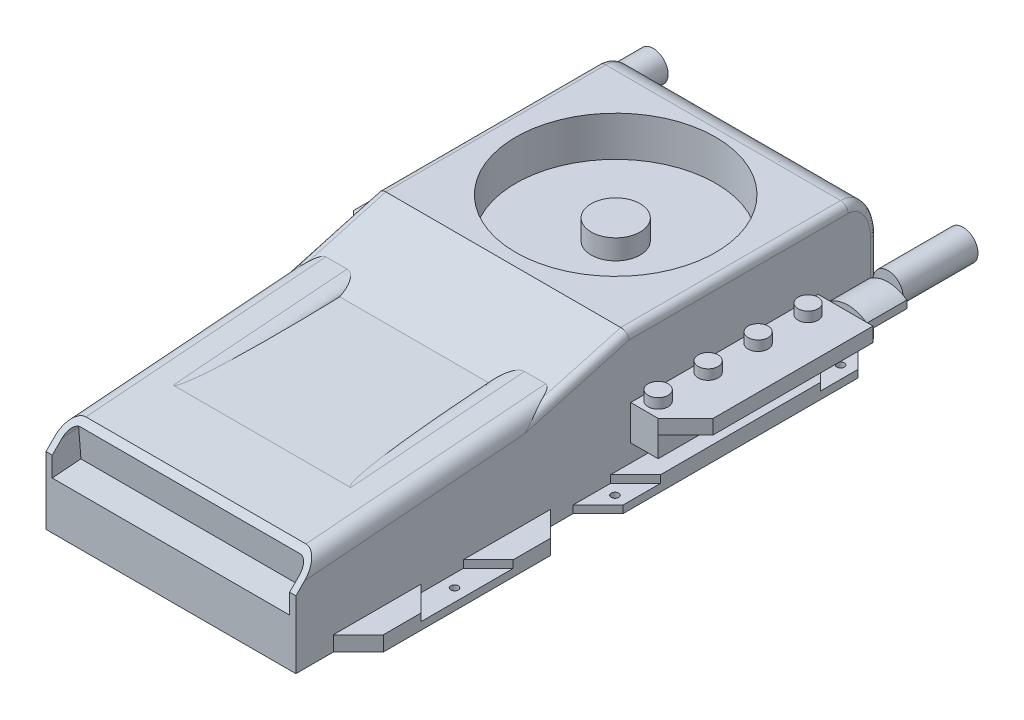
from build123d import *

# Parameters (mm, degrees)
BOSS_EXTRUDE1_DEPTH     = 50
FILLET1_SIZE            = 12
FILLET1_SIZE_2          = 16
SKETCH2_R               = 40
CUT_EXTRUDE1_DEPTH      = 16
SKETCH5_W               = 95
SKETCH5_H               = 15
CUT_EXTRUDE4_DEPTH      = 13
CUT_EXTRUDE5_DEPTH      = 29.5
FILLET2_R               = 6
FILLET3_R               = 3.5
FILLET4_R               = 3
FILLET5_SIZE            = 6
FILLET5_SIZE_2          = 2.41
FILLET6_SIZE            = 6
FILLET6_SIZE_2          = 2.41
BOSS_EXTRUDE2_DEPTH     = 6
SKETCH8_R               = 1.5
CUT_EXTRUDE6_DEPTH      = 141.983155142
CUT_EXTRUDE7_DEPTH      = 3
SKETCH10_W              = 11
SKETCH10_H              = 75
BOSS_EXTRUDE3_DEPTH     = 14
BOSS_EXTRUDE4_DEPTH     = 5.75
SKETCH11_R              = 4
BOSS_EXTRUDE5_DEPTH     = 4
LPATTERN1_COUNT         = 4
LPATTERN1_PITCH         = 20
SKETCH12_W              = 15
SKETCH12_H              = 3
BOSS_EXTRUDE6_DEPTH     = 16
BOSS_EXTRUDE7_DEPTH     = 30
MIRROR2_COPY_1_SKETCH_R = 4
MIRROR2_COPY_1_DEPTH    = 4
MIRROR2_COPY_2_SKETCH_R = 4
MIRROR2_COPY_2_DEPTH    = 4
MIRROR2_COPY_3_SKETCH_R = 4
MIRROR2_COPY_3_DEPTH    = 4
SKETCH14_R              = 9.805462556
BOSS_EXTRUDE8_DEPTH     = 8


with BuildPart() as part:
    # Sketch1 → Boss-Extrude1 (new, symmetric)
    with BuildSketch(Plane(origin=(0, 0, 0), x_dir=(0, 0, -1), z_dir=(1, 0, 0))):
        Polygon((-106.5, 18.5), (-116.5, 8.5), (-116.5, -18.5), (116.5, -18.5), (116.5, 18.5), align=None)
        Polygon((-10.5, 26), (-106.5, 18.5), (116.5, 18.5), (116.5, 33.5), (16.5, 33.5), align=None)
    extrude(amount=BOSS_EXTRUDE1_DEPTH, both=True)

    # Fillet1
    # an asymmetric fillet: 16, 12 mm, written as the material it takes off along each edge
    with BuildSketch(Plane(origin=(90, 33.5, -116.5), x_dir=(0, 0, 1), z_dir=(-1, 0, 0))) as fillet1_piece_1:
        with BuildLine():
            Bezier((FILLET1_SIZE, 0), (0, 0), (0, -FILLET1_SIZE_2), weights=[1, 0.707106781, 1])
            Line((0, -FILLET1_SIZE_2), (0, 0))
            Line((0, 0), (FILLET1_SIZE, 0))
        make_face()
    extrude(amount=180, mode=Mode.SUBTRACT)

    # Sketch2 → Cut-Extrude1 (cut)
    with BuildSketch(Plane(origin=(0, 33.5, 0), x_dir=(1, 0, 0), z_dir=(0, 1, 0))):
        with Locations(Location((0, 61.5, 0), (0, 0, 270))):
            Circle(SKETCH2_R)
    extrude(amount=-CUT_EXTRUDE1_DEPTH, mode=Mode.SUBTRACT)

    # Sketch5 → Cut-Extrude4 (cut)
    with BuildSketch(Plane(origin=(0, -9.158578015, 117.229798593), x_dir=(-1, 0, 0), z_dir=(0, 0.07788766729290961, -0.9969621413492435))):
        with Locations((0, 17.130113625)):
            Rectangle(SKETCH5_W, SKETCH5_H)
    extrude(amount=CUT_EXTRUDE4_DEPTH, mode=Mode.SUBTRACT)

    # Sketch6 → Cut-Extrude5 (cut, symmetric)
    with BuildSketch(Plane(origin=(0, 0, 0), x_dir=(0, 0, -1), z_dir=(1, 0, 0))):
        Polygon((-80.096439639, 20.562778153), (-10.5, 26), (-19.171661187, 23.591205226), align=None)
    extrude(amount=CUT_EXTRUDE5_DEPTH, both=True, mode=Mode.SUBTRACT)

    # Fillet2
    fillet2_edges = [part.edges().sort_by_distance(p)[0] for p in [
        (50, 22.25, 58.5),
        (-50, 22.25, 58.5),
    ]]
    fillet(fillet2_edges, radius=FILLET2_R)

    # Fillet3
    fillet3_edges = [part.edges().sort_by_distance(p)[0] for p in [
        (47.5, 16.307427283, 107.491035383),
        (-47.5, 16.307427283, 107.491035383),
    ]]
    fillet(fillet3_edges, radius=FILLET3_R)

    # Fillet4
    fillet4_edges = [part.edges().sort_by_distance(p)[0] for p in [
        (-50, -0.5, -116.5),
        (50, -0.5, -116.5),
        (50, 27.997177078, -113.556363297),
        (-50, 27.997177078, -113.556363297),
        (50, 33.5, -60.5),
        (-50, 33.5, -60.5),
        (-50, 25.563368562, 12.071873177),
        (50, 25.563368562, 12.071873177),
    ]]
    fillet(fillet4_edges, radius=FILLET4_R)

    # Fillet5
    # an asymmetric fillet: 6, 2.41 mm, written as the material it takes off along each edge
    with BuildSketch(Plane(origin=(-29.5, 19.394463144, 95.050871759), x_dir=(-1, 0, 0), z_dir=(0, 0.07788766729290983, -0.9969621413492435))) as fillet5_piece_1_section:
        with BuildLine():
            Bezier((FILLET5_SIZE, 0), (0, 0), (0, -FILLET5_SIZE_2), weights=[1, 0.707106781, 1])
            Line((0, -FILLET5_SIZE_2), (0, 0))
            Line((0, 0), (FILLET5_SIZE, 0))
        make_face()
    fillet5_piece_1 = extrude(amount=99.808508019, mode=Mode.PRIVATE)
    fillet5_piece_1 = split(fillet5_piece_1, bisect_by=Plane(origin=(-31.37321059, 17.883253482, 39.720287465), z_dir=(0, 0.9635179096299407, 0.26764386378609467)), keep=Keep.TOP, mode=Mode.PRIVATE)
    fillet5_piece_1 = split(fillet5_piece_1, bisect_by=Plane(origin=(-31.37321059, 22.496638276, 41.191755219), z_dir=(0, 0.9987668598742235, 0.04964634545445587)), keep=Keep.TOP, mode=Mode.PRIVATE)
    add(fillet5_piece_1, mode=Mode.SUBTRACT)

    # Fillet6
    # an asymmetric fillet: 6, 2.41 mm, written as the material it takes off along each edge
    with BuildSketch(Plane(origin=(29.5, 19.394463144, 95.050871759), x_dir=(1, 0, 0), z_dir=(0, 0.07788766729290983, -0.9969621413492435))) as fillet6_piece_1_section:
        with BuildLine():
            Bezier((FILLET6_SIZE, 0), (0, 0), (0, FILLET6_SIZE_2), weights=[1, 0.707106781, 1])
            Line((0, FILLET6_SIZE_2), (0, 0))
            Line((0, 0), (FILLET6_SIZE, 0))
        make_face()
    fillet6_piece_1 = extrude(amount=99.808508019, mode=Mode.PRIVATE)
    fillet6_piece_1 = split(fillet6_piece_1, bisect_by=Plane(origin=(31.37321059, 17.883253482, 39.720287465), z_dir=(0, 0.9635179096299407, 0.26764386378609467)), keep=Keep.TOP, mode=Mode.PRIVATE)
    fillet6_piece_1 = split(fillet6_piece_1, bisect_by=Plane(origin=(31.37321059, 22.496638276, 41.191755219), z_dir=(0, 0.9987668598742235, 0.04964634545445587)), keep=Keep.TOP, mode=Mode.PRIVATE)
    add(fillet6_piece_1, mode=Mode.SUBTRACT)

    # Sketch7 → Boss-Extrude2 (add)
    with BuildSketch(Plane.XZ.offset(18.5)):
        Polygon((-50, 101.5), (-60, 91.5), (-60, 24.5), (-50, 14.5), align=None)
        Polygon((-50, 5.5), (-60, -4.5), (-60, -98.5), (-50, -108.5), align=None)
    boss_extrude2 = extrude(amount=-BOSS_EXTRUDE2_DEPTH)

    # Sketch8 → Cut-Extrude6 (cut, through all)
    with BuildSketch(Plane.XZ.offset(18.5)):
        with Locations(Location((-55, 58, 0), (0, 0, 270))):
            Circle(SKETCH8_R)
        with Locations(Location((-55, -6.210815833, 0), (0, 0, 270))):
            Circle(SKETCH8_R)
        with Locations(Location((-55, -96.5, 0), (0, 0, 270))):
            Circle(SKETCH8_R)
    cut_extrude6 = extrude(amount=-CUT_EXTRUDE6_DEPTH, mode=Mode.SUBTRACT)

    # Sketch9 → Cut-Extrude7 (cut)
    with BuildSketch(Plane(origin=(0, -12.5, 0), x_dir=(1, 0, 0), z_dir=(0, 1, 0))):
        Polygon((-60, 83.5), (-50, 93.5), (-50, 108.5), (-60, 98.5), align=None)
        Polygon((-60, 19.5), (-50, 9.5), (-50, -5.5), (-60, 4.5), align=None)
        Polygon((-60, -39.5), (-50, -49.5), (-50, -66.5), (-60, -76.5), align=None)
    cut_extrude7 = extrude(amount=-CUT_EXTRUDE7_DEPTH, mode=Mode.SUBTRACT)

    # Mirror1: Boss-Extrude2, Cut-Extrude6, Cut-Extrude7 across plane
    add(boss_extrude2.mirror(Plane(origin=(0, 0, 0), x_dir=(0, 0, 1), z_dir=(1, 0, 0))))
    add(cut_extrude6.mirror(Plane(origin=(0, 0, 0), x_dir=(0, 0, 1), z_dir=(1, 0, 0))), mode=Mode.SUBTRACT)
    add(cut_extrude7.mirror(Plane(origin=(0, 0, 0), x_dir=(0, 0, 1), z_dir=(1, 0, 0))), mode=Mode.SUBTRACT)

    # Sketch10 → Boss-Extrude3 (add)
    with BuildSketch(Plane(origin=(0, 8.5, 0), x_dir=(1, 0, 0), z_dir=(0, 1, 0))):
        with Locations((-55.5, 55)):
            Rectangle(SKETCH10_W, SKETCH10_H)
    boss_extrude3 = extrude(amount=-BOSS_EXTRUDE3_DEPTH)

    # Sketch10<3> → Boss-Extrude4 (add)
    with BuildSketch(Plane(origin=(0, 8.5, 0), x_dir=(1, 0, 0), z_dir=(0, 1, 0))):
        Polygon((-61, 17.5), (-61, 92.5), (-72, 92.5), (-72, 28.5), align=None)
    boss_extrude4 = extrude(amount=-BOSS_EXTRUDE4_DEPTH)

    # Sketch11 → Boss-Extrude5 (add)
    with BuildSketch(Plane(origin=(0, 8.5, 0), x_dir=(1, 0, 0), z_dir=(0, 1, 0))):
        with Locations(Location((-55, 23.5, 0), (0, 0, 270))):
            Circle(SKETCH11_R)
    boss_extrude5 = extrude(amount=BOSS_EXTRUDE5_DEPTH)

    # LPattern1: Boss-Extrude5 ×4
    with Locations(*[(0, 0, -i * LPATTERN1_PITCH) for i in range(1, LPATTERN1_COUNT)]):
        add(boss_extrude5)

    # Sketch12 → Boss-Extrude6 (add)
    with BuildSketch(Plane(origin=(0, 0, -92.5), x_dir=(-1, 0, 0), z_dir=(0, 0, -1))):
        with Locations((62, 6.75)):
            Rectangle(SKETCH12_W, SKETCH12_H)
        with BuildLine():
            ThreePointArc((69.154544011, 8.5), (62, 10.75), (54.845455989, 8.5))
            Line((54.845455989, 8.5), (69.154544011, 8.5))
        make_face()
        with BuildLine():
            ThreePointArc((54.845455989, 8.5), (54.67166185, 8.376473224), (54.5, 8.25))
            Line((54.5, 8.25), (69.5, 8.25))
            ThreePointArc((69.5, 8.25), (69.32833815, 8.376473224), (69.154544011, 8.5))
            Line((69.154544011, 8.5), (54.845455989, 8.5))
        make_face()
        with BuildLine():
            Line((54.5, 5.25), (69.5, 5.25))
            ThreePointArc((69.5, 5.25), (62, 2.75), (54.5, 5.25))
        make_face()
    boss_extrude6 = extrude(amount=BOSS_EXTRUDE6_DEPTH)

    # Sketch13 → Boss-Extrude7 (add)
    with BuildSketch(Plane(origin=(0, 0, -108.5), x_dir=(-1, 0, 0), z_dir=(0, 0, -1))):
        with BuildLine():
            ThreePointArc((61.999999953, 2.75), (66.242640671, 4.507359296), (68, 8.75))
            ThreePointArc((68, 8.75), (67.995266558, 8.988283221), (67.981073702, 9.226190476))
            ThreePointArc((67.981073702, 9.226190476), (62, 10.75), (56.018926298, 9.226190476))
            ThreePointArc((56.018926298, 9.226190476), (57.592214664, 4.67919806), (61.999999953, 2.75))
        make_face()
        with BuildLine():
            ThreePointArc((56.018926298, 9.226190476), (62, 10.75), (67.981073702, 9.226190476))
            ThreePointArc((67.981073702, 9.226190476), (62, 14.75), (56.018926298, 9.226190476))
        make_face()
    boss_extrude7 = extrude(amount=BOSS_EXTRUDE7_DEPTH)

    # Mirror2: Boss-Extrude3, Boss-Extrude4, Boss-Extrude5, Boss-Extrude6, Boss-Extrude7 across plane
    add(boss_extrude3.mirror(Plane(origin=(0, 0, 0), x_dir=(0, 0, 1), z_dir=(1, 0, 0))))
    add(boss_extrude4.mirror(Plane(origin=(0, 0, 0), x_dir=(0, 0, 1), z_dir=(1, 0, 0))))
    add(boss_extrude5.mirror(Plane(origin=(0, 0, 0), x_dir=(0, 0, 1), z_dir=(1, 0, 0))))
    add(boss_extrude6.mirror(Plane(origin=(0, 0, 0), x_dir=(0, 0, 1), z_dir=(1, 0, 0))))
    add(boss_extrude7.mirror(Plane(origin=(0, 0, 0), x_dir=(0, 0, 1), z_dir=(1, 0, 0))))

    # Mirror2 copy 1 sketch → Mirror2 copy 1 (add)
    with BuildSketch(Plane(origin=(0, 8.5, -20), x_dir=(-1, 0, 0), z_dir=(0, 1, 0))):
        with Locations((-55, -23.5)):
            Circle(MIRROR2_COPY_1_SKETCH_R)
    extrude(amount=MIRROR2_COPY_1_DEPTH)

    # Mirror2 copy 2 sketch → Mirror2 copy 2 (add)
    with BuildSketch(Plane(origin=(0, 8.5, -40), x_dir=(-1, 0, 0), z_dir=(0, 1, 0))):
        with Locations((-55, -23.5)):
            Circle(MIRROR2_COPY_2_SKETCH_R)
    extrude(amount=MIRROR2_COPY_2_DEPTH)

    # Mirror2 copy 3 sketch → Mirror2 copy 3 (add)
    with BuildSketch(Plane(origin=(0, 8.5, -60), x_dir=(-1, 0, 0), z_dir=(0, 1, 0))):
        with Locations((-55, -23.5)):
            Circle(MIRROR2_COPY_3_SKETCH_R)
    extrude(amount=MIRROR2_COPY_3_DEPTH)

    # Sketch14 → Boss-Extrude8 (add)
    with BuildSketch(Plane(origin=(0, 17.5, 0), x_dir=(1, 0, 0), z_dir=(0, 1, 0))):
        with Locations(Location((0, 61.5, 0), (0, 0, 270))):
            Circle(SKETCH14_R)
    extrude(amount=BOSS_EXTRUDE8_DEPTH)


solid = part.part
